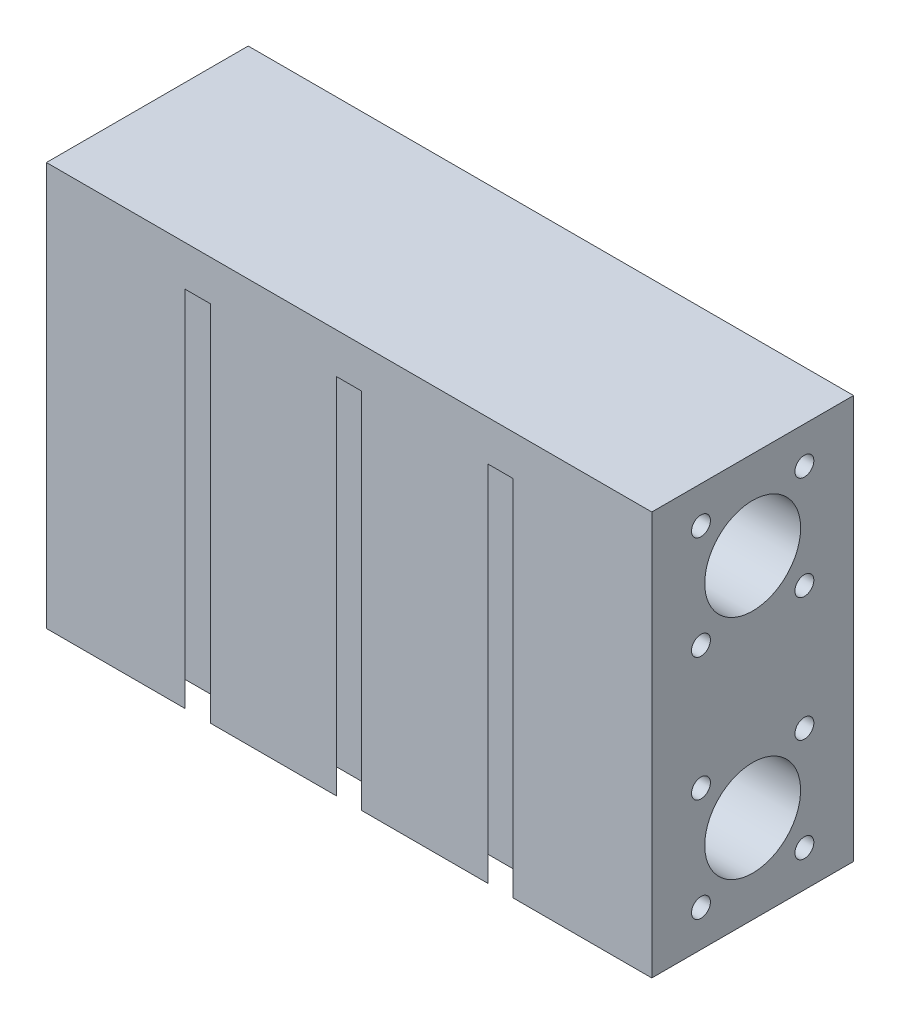
from build123d import *

# Parameters (mm, degrees)
SKETCH1_W                        = 120
SKETCH1_H                        = 80
BOSS_EXTRUDE1_DEPTH              = 40
SKETCH2_R                        = 1.85
LINEAR_BEARING_SCREW_CUTS_DEPTH  = 14
SKETCH3_R                        = 9.5
LINEAR_BEARINGS_HOLE_DEPTH       = 55
SKETCH4_R                        = 1.875
LINEAR_BEARING_SCREW_CUTS2_DEPTH = 14
CUT_EXTRUDE4_START               = -55
SKETCH5_R                        = 9.5
CUT_EXTRUDE4_DEPTH               = 55
CUT_EXTRUDE8_DEPTH               = 72


with BuildPart() as part:
    # Sketch1 → Boss-Extrude1 (new body)
    with BuildSketch(Plane.XY):
        with Locations((60, 40)):
            Rectangle(SKETCH1_W, SKETCH1_H)
    extrude(amount=BOSS_EXTRUDE1_DEPTH)

    # Sketch2 → linear-bearing-screw-cuts (cut)
    with BuildSketch(Plane.ZY):
        with Locations((30.25, 72.75)):
            Circle(SKETCH2_R)
        with Locations((9.75, 72.75)):
            Circle(SKETCH2_R)
        with Locations((30.25, 52.25)):
            Circle(SKETCH2_R)
        with Locations((9.75, 52.25)):
            Circle(SKETCH2_R)
        with Locations((9.75, 27.75)):
            Circle(SKETCH2_R)
        with Locations((30.25, 27.75)):
            Circle(SKETCH2_R)
        with Locations((30.25, 7.25)):
            Circle(SKETCH2_R)
        with Locations((9.75, 7.25)):
            Circle(SKETCH2_R)
    extrude(amount=-LINEAR_BEARING_SCREW_CUTS_DEPTH, mode=Mode.SUBTRACT)

    # Sketch3 → linear-bearings-hole (cut)
    with BuildSketch(Plane.ZY):
        with Locations((20, 62.5)):
            Circle(SKETCH3_R)
        with Locations((20, 17.5)):
            Circle(SKETCH3_R)
    extrude(amount=-LINEAR_BEARINGS_HOLE_DEPTH, mode=Mode.SUBTRACT)

    # Sketch4 → linear-bearing-screw-cuts2 (cut)
    with BuildSketch(Plane(origin=(120, 0, 0), x_dir=(0, 0, -1), z_dir=(1, 0, 0))):
        with Locations((-9.75, 72.75)):
            Circle(SKETCH4_R)
        with Locations((-30.25, 72.75)):
            Circle(SKETCH4_R)
        with Locations((-9.75, 52.25)):
            Circle(SKETCH4_R)
        with Locations((-30.25, 52.25)):
            Circle(SKETCH4_R)
        with Locations((-30.25, 27.75)):
            Circle(SKETCH4_R)
        with Locations((-9.75, 27.75)):
            Circle(SKETCH4_R)
        with Locations((-9.75, 7.25)):
            Circle(SKETCH4_R)
        with Locations((-30.25, 7.25)):
            Circle(SKETCH4_R)
    extrude(amount=-LINEAR_BEARING_SCREW_CUTS2_DEPTH, mode=Mode.SUBTRACT)

    # Sketch5 → Cut-Extrude4 (cut)
    with BuildSketch(Plane(origin=(120, 0, 0), x_dir=(0, 0, -1), z_dir=(1, 0, 0)).offset(CUT_EXTRUDE4_START)):
        with Locations((-20, 62.5)):
            Circle(SKETCH5_R)
        with Locations((-20, 17.5)):
            Circle(SKETCH5_R)
    extrude(amount=CUT_EXTRUDE4_DEPTH, mode=Mode.SUBTRACT)

    # Sketch10 → Cut-Extrude8 (cut)
    with BuildSketch(Plane.XZ):
        Polygon((87.5, 40), (82.5, 35), (97.5, 35), (92.5, 40), align=None)
        Polygon((52.5, 35), (57.5, 40), (62.5, 40), (67.5, 35), align=None)
        Polygon((22.5, 35), (27.5, 40), (32.5, 40), (37.5, 35), align=None)
    extrude(amount=-CUT_EXTRUDE8_DEPTH, mode=Mode.SUBTRACT)


solid = part.part
